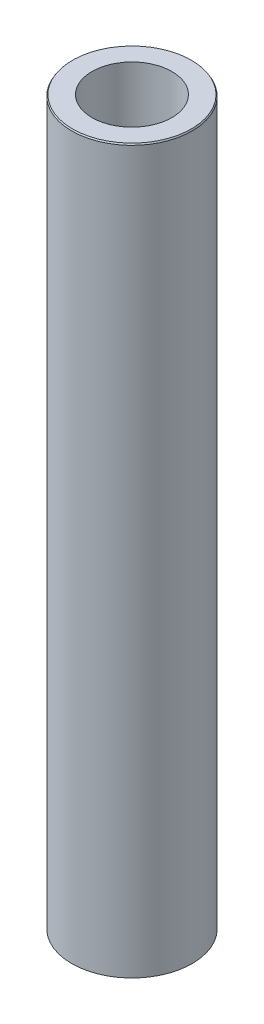
from build123d import *
from OCP.BRepFilletAPI import BRepFilletAPI_MakeChamfer

# Parameters (mm, degrees)
SKETCH1_R           = 50
BOSS_EXTRUDE1_DEPTH = 600
SKETCH2_R           = 33.147923418
CUT_EXTRUDE1_DEPTH  = 605.15229868
CHAMFER1_SIZE       = 1.143407768
CHAMFER1_SIZE2      = 0.660146783


with BuildPart() as part:
    # Sketch1 → Boss-Extrude1 (new body)
    with BuildSketch(Plane(origin=(0, 0, 0), x_dir=(1, 0, 0), z_dir=(0, 1, 0))):
        Circle(SKETCH1_R)
    extrude(amount=BOSS_EXTRUDE1_DEPTH)

    # Sketch2 → Cut-Extrude1 (cut, through all)
    with BuildSketch(Plane(origin=(0, 0, 0), x_dir=(1, 0, 0), z_dir=(0, 1, 0))):
        Circle(SKETCH2_R)
    extrude(amount=CUT_EXTRUDE1_DEPTH, mode=Mode.SUBTRACT)

    # Chamfer1: one chamfer whose edges measure the first distance from different faces: ONE call of the kernel's chamfer builder (chamfer() names one face for all edges)
    chamfer1_edges_1 = [part.edges().sort_by_distance(p)[0] for p in [
        (-50, 600, 0),
    ]]
    chamfer1_side_1 = [part.faces().sort_by_distance(p)[0] for p in [
        (-50, 300, 0),
    ]]
    chamfer1_edges_2 = [part.edges().sort_by_distance(p)[0] for p in [
        (-50, 0, 0),
    ]]
    chamfer1_side_2 = [part.faces().sort_by_distance(p)[0] for p in [
        (-48.585786438, 0, 0),
    ]]
    chamfer1 = BRepFilletAPI_MakeChamfer(part.part.solid().wrapped)
    for e in chamfer1_edges_1:
        chamfer1.Add(CHAMFER1_SIZE, CHAMFER1_SIZE2, e.wrapped, chamfer1_side_1[0].wrapped)  # the first distance lies on this face
    for e in chamfer1_edges_2:
        chamfer1.Add(CHAMFER1_SIZE, CHAMFER1_SIZE2, e.wrapped, chamfer1_side_2[0].wrapped)  # the first distance lies on this face
    add(Compound.cast(chamfer1.Shape()), mode=Mode.REPLACE)


solid = part.part
